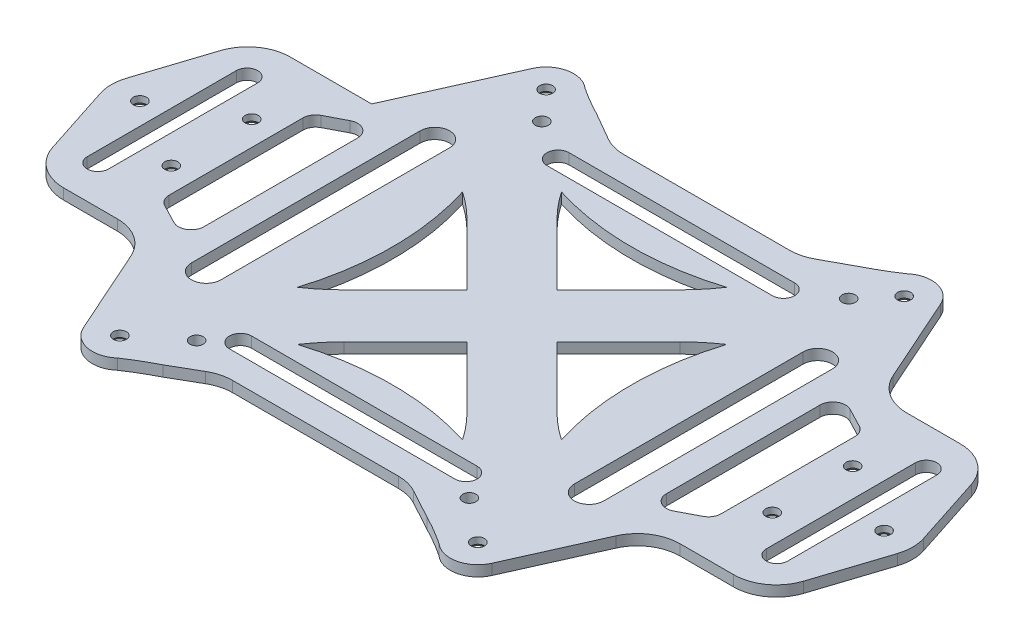
from build123d import *

# Parameters (mm, degrees)
SKETCH_1_R             = 1.55
EXTRUDE_1_DEPTH        = 2.5
CHAMFER_2_SIZE         = 1
CUT_EXTRUDE_4517_DEPTH = 111.115546384
FILLET_2_R             = 3
FILLET_3_R             = 10


with BuildPart() as part:
    # 草图1 → 凸台-拉伸1 (new body)
    with BuildSketch(Plane(origin=(0, 0, 0), x_dir=(1, 0, 0), z_dir=(0, 1, 0))):
        with BuildLine():
            Line((47.899982554, 52.633397656), (59.52497064, 26.588251477))
            Line((59.52497064, 26.588251477), (85.869588061, 26.588251477))
            Line((85.869588061, 26.588251477), (94.505759306, 0))
            Line((94.505759306, 0), (85.869588061, -26.588251477))
            Line((85.869588061, -26.588251477), (59.52497064, -26.588251477))
            Line((59.52497064, -26.588251477), (47.899982554, -52.633397656))
            ThreePointArc((47.899982554, -52.633397656), (43.362068791, -56.315801292), (37.709796983, -54.831018053))
            ThreePointArc((37.709796983, -54.831018053), (34.400449937, -52.764318952), (30.978168019, -50.89055015))
            Line((30.978168019, -50.89055015), (21.786424895, -45.89055015))
            Line((21.786424895, -45.89055015), (0, -45.89055015))
            Line((0, -45.89055015), (-22.317913981, -45.89055015))
            Line((-22.317913981, -45.89055015), (-30.978168019, -50.89055015))
            ThreePointArc((-30.978168019, -50.89055015), (-34.400449937, -52.764318952), (-37.709796983, -54.831018053))
            ThreePointArc((-37.709796983, -54.831018053), (-43.362068791, -56.315801292), (-47.899982554, -52.633397656))
            Line((-47.899982554, -52.633397656), (-59.52497064, -26.588251477))
            Line((-59.52497064, -26.588251477), (-85.869588061, -26.588251477))
            Line((-85.869588061, -26.588251477), (-94.505759306, 0))
            Line((-94.505759306, 0), (-85.869588061, 26.588251477))
            Line((-85.869588061, 26.588251477), (-59.52497064, 26.588251477))
            Line((-59.52497064, 26.588251477), (-47.899982554, 52.633397656))
            ThreePointArc((-47.899982554, 52.633397656), (-43.362068791, 56.315801292), (-37.709796983, 54.831018053))
            ThreePointArc((-37.709796983, 54.831018053), (-34.400449937, 52.764318952), (-30.978168019, 50.89055015))
            Line((-30.978168019, 50.89055015), (-22.317913981, 45.89055015))
            Line((-22.317913981, 45.89055015), (0, 45.89055015))
            Line((0, 45.89055015), (21.786424895, 45.89055015))
            Line((21.786424895, 45.89055015), (30.978168019, 50.89055015))
            ThreePointArc((30.978168019, 50.89055015), (34.400449937, 52.764318952), (37.709796983, 54.831018053))
            ThreePointArc((37.709796983, 54.831018053), (43.362068791, 56.315801292), (47.899982554, 52.633397656))
        make_face()
        with Locations((42, 50)):
            Circle(SKETCH_1_R, mode=Mode.SUBTRACT)
        with Locations((42, -50)):
            Circle(SKETCH_1_R, mode=Mode.SUBTRACT)
        with Locations((-42, -50)):
            Circle(SKETCH_1_R, mode=Mode.SUBTRACT)
        with Locations((-42, 50)):
            Circle(SKETCH_1_R, mode=Mode.SUBTRACT)
        with Locations((36, 43)):
            Circle(SKETCH_1_R, mode=Mode.SUBTRACT)
        with Locations((32, -42)):
            Circle(SKETCH_1_R, mode=Mode.SUBTRACT)
        with Locations((-32, -42)):
            Circle(SKETCH_1_R, mode=Mode.SUBTRACT)
        with Locations((-36, 43)):
            Circle(SKETCH_1_R, mode=Mode.SUBTRACT)
        with Locations((70.5, 9.435839055)):
            Circle(SKETCH_1_R, mode=Mode.SUBTRACT)
        with Locations((70.5, -9.435839055)):
            Circle(SKETCH_1_R, mode=Mode.SUBTRACT)
        with Locations((-70.5, -9.435839055)):
            Circle(SKETCH_1_R, mode=Mode.SUBTRACT)
        with Locations((-70.5, 9.435839055)):
            Circle(SKETCH_1_R, mode=Mode.SUBTRACT)
        with Locations((87.3, 0)):
            Circle(SKETCH_1_R, mode=Mode.SUBTRACT)
        with Locations((-87.3, 0)):
            Circle(SKETCH_1_R, mode=Mode.SUBTRACT)
        with BuildLine():
            Line((77.169642998, -17.5), (77.169642998, 17.5))
            ThreePointArc((77.169642998, 17.5), (79.669642998, 20), (82.169642998, 17.5))
            Line((82.169642998, 17.5), (82.169642998, -17.5))
            ThreePointArc((82.169642998, -17.5), (79.669642998, -20), (77.169642998, -17.5))
        make_face(mode=Mode.SUBTRACT)
        with BuildLine():
            Line((-77.169642998, -17.5), (-77.169642998, 17.5))
            ThreePointArc((-77.169642998, 17.5), (-79.669642998, 20), (-82.169642998, 17.5))
            Line((-82.169642998, 17.5), (-82.169642998, -17.5))
            ThreePointArc((-82.169642998, -17.5), (-79.669642998, -20), (-77.169642998, -17.5))
        make_face(mode=Mode.SUBTRACT)
        with BuildLine():
            Line((-24.995975583, 14.429581723), (-10.56639386, 0))
            Line((-10.56639386, 0), (-24.995975583, -14.429581723))
            ThreePointArc((-24.995975583, -14.429581723), (-27.869597938, -17.042325553), (-30.978168019, -19.370614155))
            ThreePointArc((-30.978168019, -19.370614155), (-28.024295248, 0), (-30.978168019, 19.370614155))
            ThreePointArc((-30.978168019, 19.370614155), (-27.869597938, 17.042325553), (-24.995975583, 14.429581723))
        make_face(mode=Mode.SUBTRACT)
        with BuildLine():
            Line((14.429581723, 24.995975583), (0, 10.56639386))
            Line((0, 10.56639386), (-14.429581723, 24.995975583))
            ThreePointArc((-14.429581723, 24.995975583), (-17.042325553, 27.869597938), (-19.370614155, 30.978168019))
            ThreePointArc((-19.370614155, 30.978168019), (0, 28.024295248), (19.370614155, 30.978168019))
            ThreePointArc((19.370614155, 30.978168019), (17.042325553, 27.869597938), (14.429581723, 24.995975583))
        make_face(mode=Mode.SUBTRACT)
        with BuildLine():
            Line((24.995975583, -14.429581723), (10.56639386, 0))
            Line((10.56639386, 0), (24.995975583, 14.429581723))
            ThreePointArc((24.995975583, 14.429581723), (27.869597938, 17.042325553), (30.978168019, 19.370614155))
            ThreePointArc((30.978168019, 19.370614155), (28.024295248, 0), (30.978168019, -19.370614155))
            ThreePointArc((30.978168019, -19.370614155), (27.869597938, -17.042325553), (24.995975583, -14.429581723))
        make_face(mode=Mode.SUBTRACT)
        with BuildLine():
            Line((-14.429581723, -24.995975583), (0, -10.56639386))
            Line((0, -10.56639386), (14.429581723, -24.995975583))
            ThreePointArc((14.429581723, -24.995975583), (17.042325553, -27.869597938), (19.370614155, -30.978168019))
            ThreePointArc((19.370614155, -30.978168019), (0, -28.024295248), (-19.370614155, -30.978168019))
            ThreePointArc((-19.370614155, -30.978168019), (-17.042325553, -27.869597938), (-14.429581723, -24.995975583))
        make_face(mode=Mode.SUBTRACT)
        with BuildLine():
            Line((41.468701347, -26.829343455), (41.468701347, 26.829343455))
            ThreePointArc((41.468701347, 26.829343455), (44.919200659, 30.279842767), (48.36969997, 26.829343455))
            Line((48.36969997, 26.829343455), (48.36969997, -26.829343455))
            ThreePointArc((48.36969997, -26.829343455), (44.919200659, -30.279842767), (41.468701347, -26.829343455))
        make_face(mode=Mode.SUBTRACT)
        with BuildLine():
            Line((-26.453510137, -34.636976429), (26.453510137, -34.636976429))
            ThreePointArc((26.453510137, -34.636976429), (29.060662927, -37.244129219), (26.453510137, -39.851282009))
            Line((26.453510137, -39.851282009), (-26.453510137, -39.851282009))
            ThreePointArc((-26.453510137, -39.851282009), (-29.060662927, -37.244129219), (-26.453510137, -34.636976429))
        make_face(mode=Mode.SUBTRACT)
        with BuildLine():
            Line((-26.453510137, 34.636976429), (26.453510137, 34.636976429))
            ThreePointArc((26.453510137, 34.636976429), (29.060662927, 37.244129219), (26.453510137, 39.851282009))
            Line((26.453510137, 39.851282009), (-26.453510137, 39.851282009))
            ThreePointArc((-26.453510137, 39.851282009), (-29.060662927, 37.244129219), (-26.453510137, 34.636976429))
        make_face(mode=Mode.SUBTRACT)
        with BuildLine():
            Line((-41.468701347, -26.829343455), (-41.468701347, 26.829343455))
            ThreePointArc((-41.468701347, 26.829343455), (-44.919200659, 30.279842767), (-48.36969997, 26.829343455))
            Line((-48.36969997, 26.829343455), (-48.36969997, -26.829343455))
            ThreePointArc((-48.36969997, -26.829343455), (-44.919200659, -30.279842767), (-41.468701347, -26.829343455))
        make_face(mode=Mode.SUBTRACT)
    extrude(amount=EXTRUDE_1_DEPTH)

    # 倒角2
    chamfer_2_edges = [part.edges().sort_by_distance(p)[0] for p in [
        (-72.05, 0, 9.435839055),
        (-72.05, 0, -9.435839055),
        (68.95, 0, 9.435839055),
        (68.95, 0, -9.435839055),
        (-88.85, 0, 0),
        (85.75, 0, 0),
        (-43.55, 0, 50),
        (40.45, 0, 50),
        (-43.55, 0, -50),
        (40.45, 0, -50),
    ]]
    chamfer(chamfer_2_edges, length=CHAMFER_2_SIZE)

    # Sketch 4272 → Cut-Extrude 4517 (cut, through all)
    with BuildSketch(Plane.XZ):
        Polygon((-64.75, 17.5), (-54.25, 22.965954031), (-54.25, -22.965954031), (-64.75, -17.5), align=None)
        Polygon((54.25, -22.965954031), (64.75, -17.5), (64.75, 17.5), (54.25, 22.965954031), align=None)
    extrude(amount=-CUT_EXTRUDE_4517_DEPTH, mode=Mode.SUBTRACT)

    # 圆角2
    fillet_2_edges = [part.edges().sort_by_distance(p)[0] for p in [
        (64.75, 1.25, 17.5),
        (64.75, 1.25, -17.5),
        (54.25, 1.25, -22.965954031),
        (54.25, 1.25, 22.965954031),
        (-54.25, 1.25, -22.965954031),
        (-64.75, 1.25, -17.5),
        (-64.75, 1.25, 17.5),
        (-54.25, 1.25, 22.965954031),
    ]]
    fillet(fillet_2_edges, radius=FILLET_2_R)

    # 圆角3
    fillet_3_edges = [part.edges().sort_by_distance(p)[0] for p in [
        (21.786424895, 1.25, 45.89055015),
        (-22.317913981, 1.25, 45.89055015),
        (21.786424895, 1.25, -45.89055015),
        (-22.317913981, 1.25, -45.89055015),
        (59.52497064, 1.25, -26.588251477),
        (85.869588061, 1.25, -26.588251477),
        (94.505759306, 1.25, 0),
        (85.869588061, 1.25, 26.588251477),
        (59.52497064, 1.25, 26.588251477),
        (-59.52497064, 1.25, 26.588251477),
        (-85.869588061, 1.25, -26.588251477),
        (-94.505759306, 1.25, 0),
        (-85.869588061, 1.25, 26.588251477),
    ]]
    fillet(fillet_3_edges, radius=FILLET_3_R)


solid = part.part
